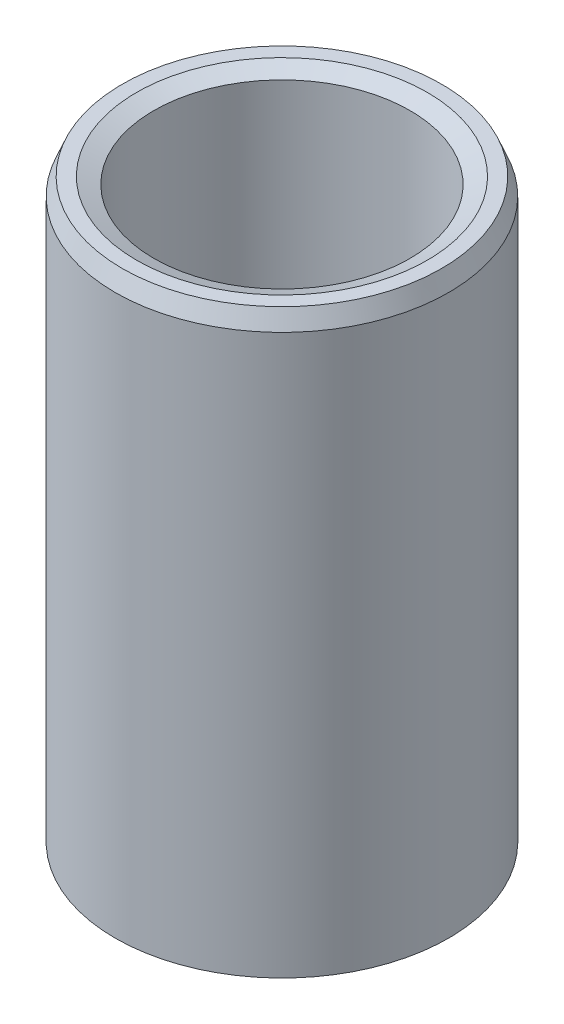
from build123d import *
from OCP.BRepFilletAPI import BRepFilletAPI_MakeChamfer

# Parameters (mm, degrees)
SKETCH1_R           = 25
BOSS_EXTRUDE1_DEPTH = 87.48029661
SKETCH2_R           = 19.207409249
CUT_EXTRUDE1_DEPTH  = 95.354662285
CHAMFER1_SIZE       = 2.590606564
CHAMFER1_SIZE2      = 1.057656775


with BuildPart() as part:
    # Sketch1 → Boss-Extrude1 (new body)
    with BuildSketch(Plane(origin=(0, 0, 0), x_dir=(1, 0, 0), z_dir=(0, 1, 0))):
        Circle(SKETCH1_R)
    extrude(amount=BOSS_EXTRUDE1_DEPTH)

    # Sketch2 → Cut-Extrude1 (cut, through all)
    with BuildSketch(Plane(origin=(0, 0, 0), x_dir=(1, 0, 0), z_dir=(0, 1, 0))):
        Circle(SKETCH2_R)
    extrude(amount=CUT_EXTRUDE1_DEPTH, mode=Mode.SUBTRACT)

    # Chamfer1: one chamfer whose edges measure the first distance from different faces: ONE call of the kernel's chamfer builder (chamfer() names one face for all edges)
    chamfer1_edges_1 = [part.edges().sort_by_distance(p)[0] for p in [
        (-19.207409249, 87.48029661, 0),
    ]]
    chamfer1_side_1 = [part.faces().sort_by_distance(p)[0] for p in [
        (-24.292893219, 87.48029661, 0),
    ]]
    chamfer1_edges_2 = [part.edges().sort_by_distance(p)[0] for p in [
        (-19.207409249, 0, 0),
    ]]
    chamfer1_side_2 = [part.faces().sort_by_distance(p)[0] for p in [
        (-19.207409249, 43.740148305, 0),
    ]]
    chamfer1_edges_3 = [part.edges().sort_by_distance(p)[0] for p in [
        (-25, 0, 0),
    ]]
    chamfer1_side_3 = [part.faces().sort_by_distance(p)[0] for p in [
        (-24.292893219, 0, 0),
    ]]
    chamfer1_edges_4 = [part.edges().sort_by_distance(p)[0] for p in [
        (-25, 87.48029661, 0),
    ]]
    chamfer1_side_4 = [part.faces().sort_by_distance(p)[0] for p in [
        (-25, 43.740148305, 0),
    ]]
    chamfer1 = BRepFilletAPI_MakeChamfer(part.part.solid().wrapped)
    for e in chamfer1_edges_1:
        chamfer1.Add(CHAMFER1_SIZE, CHAMFER1_SIZE2, e.wrapped, chamfer1_side_1[0].wrapped)  # the first distance lies on this face
    for e in chamfer1_edges_2:
        chamfer1.Add(CHAMFER1_SIZE, CHAMFER1_SIZE2, e.wrapped, chamfer1_side_2[0].wrapped)  # the first distance lies on this face
    for e in chamfer1_edges_3:
        chamfer1.Add(CHAMFER1_SIZE, CHAMFER1_SIZE2, e.wrapped, chamfer1_side_3[0].wrapped)  # the first distance lies on this face
    for e in chamfer1_edges_4:
        chamfer1.Add(CHAMFER1_SIZE, CHAMFER1_SIZE2, e.wrapped, chamfer1_side_4[0].wrapped)  # the first distance lies on this face
    add(Compound.cast(chamfer1.Shape()), mode=Mode.REPLACE)


solid = part.part
